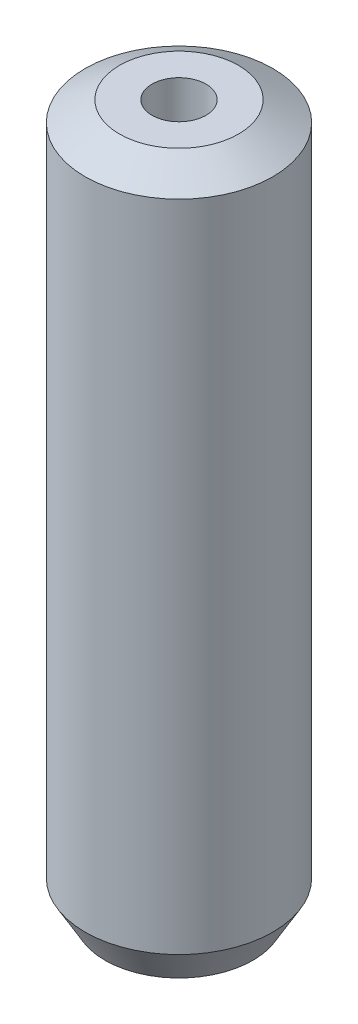
from build123d import *
from OCP.BRepFilletAPI import BRepFilletAPI_MakeChamfer

# Parameters (mm, degrees)
SKETCH1_R           = 5
BOSS_EXTRUDE1_DEPTH = 37.750936279
SKETCH2_R           = 1.440601131
CUT_EXTRUDE1_DEPTH  = 39.407462685
CHAMFER1_SIZE       = 1.055720426
CHAMFER1_SIZE2      = 1.828561416


with BuildPart() as part:
    # Sketch1 → Boss-Extrude1 (new body)
    with BuildSketch(Plane(origin=(0, 0, 0), x_dir=(1, 0, 0), z_dir=(0, 1, 0))):
        Circle(SKETCH1_R)
    extrude(amount=BOSS_EXTRUDE1_DEPTH)

    # Sketch2 → Cut-Extrude1 (cut, through all)
    with BuildSketch(Plane(origin=(0, 0, 0), x_dir=(1, 0, 0), z_dir=(0, 1, 0))):
        Circle(SKETCH2_R)
    extrude(amount=CUT_EXTRUDE1_DEPTH, mode=Mode.SUBTRACT)

    # Chamfer1: one chamfer whose edges measure the first distance from different faces: ONE call of the kernel's chamfer builder (chamfer() names one face for all edges)
    chamfer1_edges_1 = [part.edges().sort_by_distance(p)[0] for p in [
        (-5, 37.750936279, 0),
    ]]
    chamfer1_side_1 = [part.faces().sort_by_distance(p)[0] for p in [
        (-5, 18.875468139, 0),
    ]]
    chamfer1_edges_2 = [part.edges().sort_by_distance(p)[0] for p in [
        (-5, 0, 0),
    ]]
    chamfer1_side_2 = [part.faces().sort_by_distance(p)[0] for p in [
        (-4.858578644, 0, 0),
    ]]
    chamfer1 = BRepFilletAPI_MakeChamfer(part.part.solid().wrapped)
    for e in chamfer1_edges_1:
        chamfer1.Add(CHAMFER1_SIZE, CHAMFER1_SIZE2, e.wrapped, chamfer1_side_1[0].wrapped)  # the first distance lies on this face
    for e in chamfer1_edges_2:
        chamfer1.Add(CHAMFER1_SIZE, CHAMFER1_SIZE2, e.wrapped, chamfer1_side_2[0].wrapped)  # the first distance lies on this face
    add(Compound.cast(chamfer1.Shape()), mode=Mode.REPLACE)


solid = part.part
